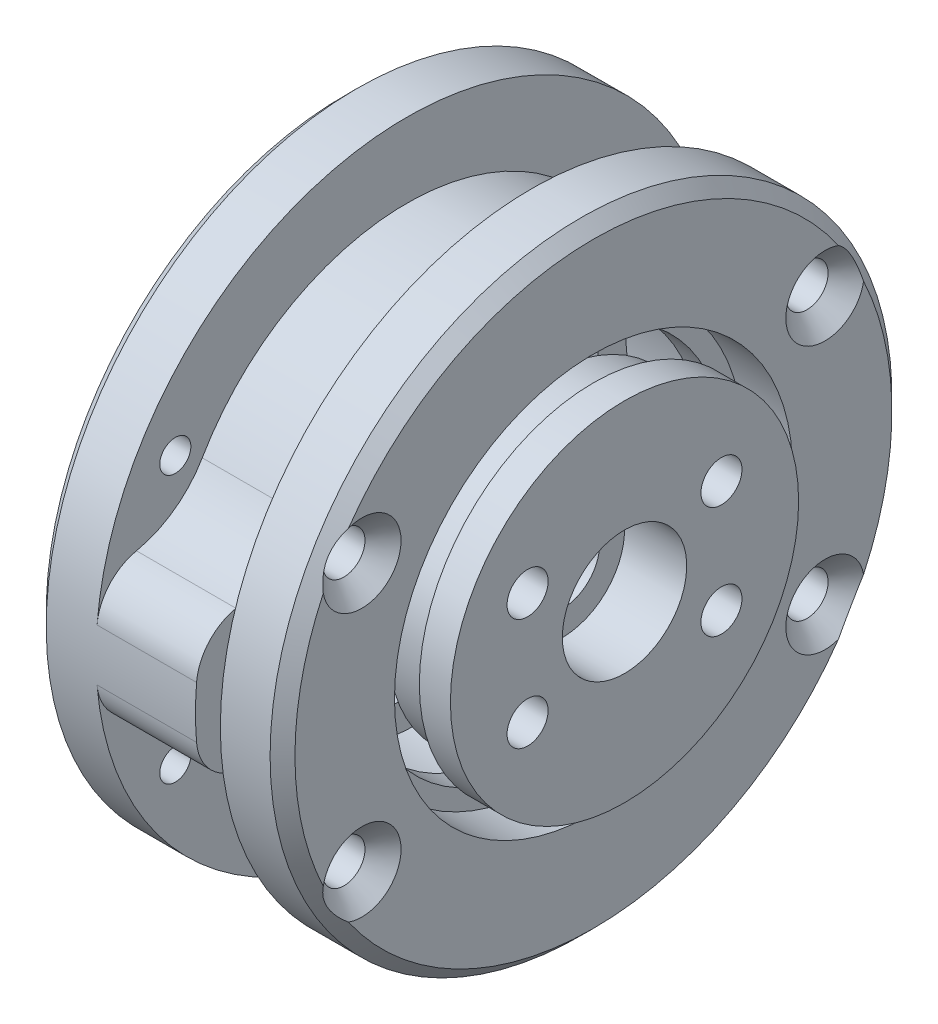
from build123d import *

# Parameters (mm, degrees)
CUT_EXTRUDE1_DEPTH                             = 24.414738948
CUT_EXTRUDE1_DEPTH_BACK                        = 24.414738948
SKETCH3_W                                      = 2
SKETCH3_H                                      = 3.75
CUT_EXTRUDE8_DEPTH                             = 24.414738948
CUT_EXTRUDE8_DEPTH_BACK                        = 24.414738948
SKETCH5_W                                      = 2
SKETCH5_H                                      = 5.5
SKETCH9_W                                      = 1.65
SKETCH9_H                                      = 25
M4X0_7_TAPPED_HOLE1_AT_2_COUNT                 = 2
M4X0_7_TAPPED_HOLE1_AT_2_PITCH                 = 15.588457268
M4X0_7_TAPPED_HOLE1_AT_3_COUNT                 = 2
M4X0_7_TAPPED_HOLE1_AT_3_PITCH                 = 18
M4X0_7_TAPPED_HOLE1_AT_4_COUNT                 = 2
M4X0_7_TAPPED_HOLE1_AT_4_PITCH                 = 9
BOSS_EXTRUDE1_DEPTH                            = 5
BOSS_EXTRUDE1_DEPTH_BACK                       = 3
CSK_FOR_M3_FLAT_HEAD_MACHINE_SCREW1_AT_2_COUNT = 2
CSK_FOR_M3_FLAT_HEAD_MACHINE_SCREW1_AT_2_PITCH = 21.5
CSK_FOR_M3_FLAT_HEAD_MACHINE_SCREW1_AT_3_COUNT = 2
CSK_FOR_M3_FLAT_HEAD_MACHINE_SCREW1_AT_3_PITCH = 37.239092363
CSK_FOR_M3_FLAT_HEAD_MACHINE_SCREW1_AT_4_COUNT = 2
CSK_FOR_M3_FLAT_HEAD_MACHINE_SCREW1_AT_4_PITCH = 43
SKETCH17_W                                     = 1.25
SKETCH17_H                                     = 22.5
M3X0_5_TAPPED_HOLE1_AT_2_COUNT                 = 2
M3X0_5_TAPPED_HOLE1_AT_2_PITCH                 = 21.5
M3X0_5_TAPPED_HOLE1_AT_3_COUNT                 = 2
M3X0_5_TAPPED_HOLE1_AT_3_PITCH                 = 43
M3X0_5_TAPPED_HOLE1_AT_4_COUNT                 = 2
M3X0_5_TAPPED_HOLE1_AT_4_PITCH                 = 37.239092363
CHAMFER2_SIZE                                  = 1
CHAMFER3_SIZE                                  = 1
CUT_EXTRUDE9_DEPTH                             = 44.301270247


with BuildPart() as part:
    # Sketch2 → Revolve1 (revolve)
    with BuildSketch(Plane.XY, mode=Mode.PRIVATE) as revolve1_sk:
        Polygon((-4, 6.5), (5, 6.5), (5, 3), (-2.5, 3), (-2.5, 1.65), (-12.5, 1.65), (-12.5, 14), (-10, 14), (-10, 12.5), (-6, 12.5), (-6, 9.5), (-4, 7.5), align=None)
    revolve(revolve1_sk.sketch.rotate(Axis((-18.53804691, 0, 0), (1, 0, 0)), 90), axis=Axis((-18.53804691, 0, 0), (1, 0, 0)))

    # Sketch3 → Cut-Extrude1 (cut, two sides: drawn at the far end of the back side and taken through both)
    with BuildSketch(Plane.XY.offset(-CUT_EXTRUDE1_DEPTH_BACK)):
        with Locations((4, 4.625)):
            Rectangle(SKETCH3_W, SKETCH3_H)
        with Locations((4, -4.625)):
            Rectangle(SKETCH3_W, SKETCH3_H)
    extrude(amount=CUT_EXTRUDE1_DEPTH + CUT_EXTRUDE1_DEPTH_BACK, mode=Mode.SUBTRACT)


with BuildPart() as body_2:
    # Sketch4 → Revolve2 (revolve)
    with BuildSketch(Plane.XY, mode=Mode.PRIVATE) as revolve2_sk:
        Polygon((4, 6.5), (6, 8.5), (6, 12.5), (10, 12.5), (10, 14), (12.5, 14), (12.5, 5), (7.5, 5), (7.5, 3), (3, 3), (3, 6.5), align=None)
    revolve(revolve2_sk.sketch.rotate(Axis((-18.53804691, 0, 0), (1, 0, 0)), 90), axis=Axis((-18.53804691, 0, 0), (1, 0, 0)))

    # Sketch5 → Cut-Extrude8 (cut, two sides: drawn at the far end of the back side and taken through both)
    with BuildSketch(Plane.XY.offset(-CUT_EXTRUDE8_DEPTH_BACK)):
        with Locations((4, 0)):
            Rectangle(SKETCH5_W, SKETCH5_H)
    extrude(amount=CUT_EXTRUDE8_DEPTH + CUT_EXTRUDE8_DEPTH_BACK, mode=Mode.SUBTRACT)


with BuildPart() as body_3:
    # Sketch6 → Revolve3 (revolve)
    with BuildSketch(Plane.XY, mode=Mode.PRIVATE) as revolve3_sk:
        Polygon((-10, 16), (-10, 25), (-5, 25), (-5, 19), (3, 19), (3, 16.7), (-4, 16.7), (-4, 14.5), (-6, 14.5), (-6, 16), align=None)
    revolve(revolve3_sk.sketch.rotate(Axis((-18.53804691, 0, 0), (1, 0, 0)), 90), axis=Axis((-18.53804691, 0, 0), (1, 0, 0)))

    # Sketch10 → Boss-Extrude1 (add, two sides: drawn at the far end of the back side and taken through both)
    with BuildSketch(Plane.ZY.offset(-BOSS_EXTRUDE1_DEPTH_BACK)):
        with BuildLine():
            ThreePointArc((-16.454482672, 9.5), (-19, 0), (-16.454482672, -9.5))
            ThreePointArc((-16.454482672, -9.5), (-18.691123744, -7.020089159), (-21.745307719, -5.669355538))
            ThreePointArc((-21.745307719, -5.669355538), (-23.92288279, -4.404014641), (-24.912641223, -2.08813489))
            ThreePointArc((-24.912641223, -2.08813489), (-25, 0), (-24.912641223, 2.08813489))
            ThreePointArc((-24.912641223, 2.08813489), (-23.92288279, 4.404014641), (-21.745307719, 5.669355538))
            ThreePointArc((-21.745307719, 5.669355538), (-18.691123744, 7.020089159), (-16.454482672, 9.5))
        make_face()
        with BuildLine():
            ThreePointArc((16.454482672, -9.5), (19, 0), (16.454482672, 9.5))
            ThreePointArc((16.454482672, 9.5), (18.691123744, 7.020089159), (21.745307719, 5.669355538))
            ThreePointArc((21.745307719, 5.669355538), (23.92288279, 4.404014641), (24.912641223, 2.08813489))
            ThreePointArc((24.912641223, 2.08813489), (25, 0), (24.912641223, -2.08813489))
            ThreePointArc((24.912641223, -2.08813489), (23.92288279, -4.404014641), (21.745307719, -5.669355538))
            ThreePointArc((21.745307719, -5.669355538), (18.691123744, -7.020089159), (16.454482672, -9.5))
        make_face()
    extrude(amount=BOSS_EXTRUDE1_DEPTH + BOSS_EXTRUDE1_DEPTH_BACK)

    # Sketch17 → M3x0.5 Tapped Hole1 (revolve, cut)
    with BuildSketch(Plane(origin=(-10, 10.75, 18.619546181), x_dir=(0, 0, 1), z_dir=(0, 1, 0))):
        with Locations((0.625, 11.25)):
            Rectangle(SKETCH17_W, SKETCH17_H)
    m3x0_5_tapped_hole1 = revolve(axis=Axis((-16.35, 10.75, 18.619546181), (1, 0, 0)), mode=Mode.SUBTRACT)

    # M3x0.5 Tapped Hole1 at 2: M3x0.5 Tapped Hole1 ×2
    with Locations(*[(0, -i * M3X0_5_TAPPED_HOLE1_AT_2_PITCH, 0) for i in range(1, M3X0_5_TAPPED_HOLE1_AT_2_COUNT)]):
        add(m3x0_5_tapped_hole1, mode=Mode.SUBTRACT)

    # M3x0.5 Tapped Hole1 at 3: M3x0.5 Tapped Hole1 ×2
    with Locations(*[Vector(0, -0.5000000000000013, -0.8660254037844379) * (i * M3X0_5_TAPPED_HOLE1_AT_3_PITCH) for i in range(1, M3X0_5_TAPPED_HOLE1_AT_3_COUNT)]):
        add(m3x0_5_tapped_hole1, mode=Mode.SUBTRACT)

    # M3x0.5 Tapped Hole1 at 4: M3x0.5 Tapped Hole1 ×2
    with Locations(*[(0, 0, -i * M3X0_5_TAPPED_HOLE1_AT_4_PITCH) for i in range(1, M3X0_5_TAPPED_HOLE1_AT_4_COUNT)]):
        add(m3x0_5_tapped_hole1, mode=Mode.SUBTRACT)

    # Chamfer3
    chamfer3_edges = [body_3.edges().sort_by_distance(p)[0] for p in [
        (-10, 0, -25),
    ]]
    chamfer(chamfer3_edges, length=CHAMFER3_SIZE)


with BuildPart() as body_4:
    # Sketch7 → Revolve4 (revolve)
    with BuildSketch(Plane.XY, mode=Mode.PRIVATE) as revolve4_sk:
        Polygon((4, 16.7), (4, 14.5), (6, 14.5), (6, 16), (10, 16), (10, 25), (5, 25), (5, 19), (3, 19), (3, 16.7), align=None)
    revolve(revolve4_sk.sketch.rotate(Axis((-18.53804691, 0, 0), (1, 0, 0)), 90), axis=Axis((-18.53804691, 0, 0), (1, 0, 0)))

    # Sketch15 → CSK for M3 Flat Head Machine Screw1 (revolve, cut)
    with BuildSketch(Plane(origin=(10, -10.75, 18.619546181), x_dir=(0, 0, -1), z_dir=(0, 1, 0))):
        Polygon((0, 0), (0, 22.5), (1.7, 22.5), (1.7, 1.45), (3.15, 0), align=None)
    csk_for_m3_flat_head_machine_screw1 = revolve(axis=Axis((16.35, -10.75, 18.619546181), (-1, 0, 0)), mode=Mode.SUBTRACT)

    # CSK for M3 Flat Head Machine Screw1 at 2: CSK for M3 Flat Head Machine Screw1 ×2
    with Locations(*[(0, i * CSK_FOR_M3_FLAT_HEAD_MACHINE_SCREW1_AT_2_PITCH, 0) for i in range(1, CSK_FOR_M3_FLAT_HEAD_MACHINE_SCREW1_AT_2_COUNT)]):
        add(csk_for_m3_flat_head_machine_screw1, mode=Mode.SUBTRACT)

    # CSK for M3 Flat Head Machine Screw1 at 3: CSK for M3 Flat Head Machine Screw1 ×2
    with Locations(*[(0, 0, -i * CSK_FOR_M3_FLAT_HEAD_MACHINE_SCREW1_AT_3_PITCH) for i in range(1, CSK_FOR_M3_FLAT_HEAD_MACHINE_SCREW1_AT_3_COUNT)]):
        add(csk_for_m3_flat_head_machine_screw1, mode=Mode.SUBTRACT)

    # CSK for M3 Flat Head Machine Screw1 at 4: CSK for M3 Flat Head Machine Screw1 ×2
    with Locations(*[Vector(0, 0.5000000000000013, -0.8660254037844379) * (i * CSK_FOR_M3_FLAT_HEAD_MACHINE_SCREW1_AT_4_PITCH) for i in range(1, CSK_FOR_M3_FLAT_HEAD_MACHINE_SCREW1_AT_4_COUNT)]):
        add(csk_for_m3_flat_head_machine_screw1, mode=Mode.SUBTRACT)

    # Chamfer2
    # the kernel refuses this chamfer: 1 mm, written as the material it takes off along each edge
    with BuildSketch(Plane(origin=(10, 0, 0), x_dir=(0, 0, 1), z_dir=(0, 1, 0))) as chamfer2_piece_1:
        Polygon((25 - CHAMFER2_SIZE, 0), (25, -CHAMFER2_SIZE), (25, 0), align=None)
    revolve(axis=Axis((10, 0, 0), (1, 0, 0)), mode=Mode.SUBTRACT)


with BuildPart() as m4x0_7_tapped_hole1_tool:
    # Sketch9 → M4x0.7 Tapped Hole1 (revolve)
    with BuildSketch(Plane(origin=(-12.5, 4.5, -7.794228634), x_dir=(0, 0, 1), z_dir=(0, 1, 0))):
        with Locations((0.825, 12.5)):
            Rectangle(SKETCH9_W, SKETCH9_H)
    m4x0_7_tapped_hole1 = revolve(axis=Axis((-18.85, 4.5, -7.794228634), (1, 0, 0)))


with BuildPart() as part_1:
    add(part.part)

    # M4x0.7 Tapped Hole1: cut by m4x0_7_tapped_hole1_tool
    add(m4x0_7_tapped_hole1_tool.part, mode=Mode.SUBTRACT)


with BuildPart() as body_2_1:
    add(body_2.part)

    # M4x0.7 Tapped Hole1: cut by m4x0_7_tapped_hole1_tool
    add(m4x0_7_tapped_hole1_tool.part, mode=Mode.SUBTRACT)


with BuildPart() as m4x0_7_tapped_hole1_at_2_tool:
    # M4x0.7 Tapped Hole1 at 2: M4x0.7 Tapped Hole1 ×2
    with Locations(*[(0, 0, i * M4X0_7_TAPPED_HOLE1_AT_2_PITCH) for i in range(1, M4X0_7_TAPPED_HOLE1_AT_2_COUNT)]):
        add(m4x0_7_tapped_hole1)


with BuildPart() as part_2:
    add(part_1.part)

    # M4x0.7 Tapped Hole1 at 2: cut by m4x0_7_tapped_hole1_at_2_tool
    add(m4x0_7_tapped_hole1_at_2_tool.part, mode=Mode.SUBTRACT)


with BuildPart() as body_2_2:
    add(body_2_1.part)

    # M4x0.7 Tapped Hole1 at 2: cut by m4x0_7_tapped_hole1_at_2_tool
    add(m4x0_7_tapped_hole1_at_2_tool.part, mode=Mode.SUBTRACT)


with BuildPart() as m4x0_7_tapped_hole1_at_3_tool:
    # M4x0.7 Tapped Hole1 at 3: M4x0.7 Tapped Hole1 ×2
    with Locations(*[Vector(0, -0.5, 0.8660254037844387) * (i * M4X0_7_TAPPED_HOLE1_AT_3_PITCH) for i in range(1, M4X0_7_TAPPED_HOLE1_AT_3_COUNT)]):
        add(m4x0_7_tapped_hole1)


with BuildPart() as part_3:
    add(part_2.part)

    # M4x0.7 Tapped Hole1 at 3: cut by m4x0_7_tapped_hole1_at_3_tool
    add(m4x0_7_tapped_hole1_at_3_tool.part, mode=Mode.SUBTRACT)


with BuildPart() as body_2_3:
    add(body_2_2.part)

    # M4x0.7 Tapped Hole1 at 3: cut by m4x0_7_tapped_hole1_at_3_tool
    add(m4x0_7_tapped_hole1_at_3_tool.part, mode=Mode.SUBTRACT)


with BuildPart() as m4x0_7_tapped_hole1_at_4_tool:
    # M4x0.7 Tapped Hole1 at 4: M4x0.7 Tapped Hole1 ×2
    with Locations(*[(0, -i * M4X0_7_TAPPED_HOLE1_AT_4_PITCH, 0) for i in range(1, M4X0_7_TAPPED_HOLE1_AT_4_COUNT)]):
        add(m4x0_7_tapped_hole1)


with BuildPart() as part_4:
    add(part_3.part)

    # M4x0.7 Tapped Hole1 at 4: cut by m4x0_7_tapped_hole1_at_4_tool
    add(m4x0_7_tapped_hole1_at_4_tool.part, mode=Mode.SUBTRACT)

    # Sketch18 → Cut-Extrude9 (cut, through all)
    with BuildSketch(Plane.ZY.offset(12.5)):
        with BuildLine():
            Line((-4.5, 13.257073584), (-4.5, 7.257073584))
            Line((-4.5, 7.257073584), (4.5, 7.257073584))
            Line((4.5, 7.257073584), (4.5, 13.257073584))
            ThreePointArc((4.5, 13.257073584), (0, 14), (-4.5, 13.257073584))
        make_face()
    extrude(amount=-CUT_EXTRUDE9_DEPTH, mode=Mode.SUBTRACT)


with BuildPart() as body_2_4:
    add(body_2_3.part)

    # M4x0.7 Tapped Hole1 at 4: cut by m4x0_7_tapped_hole1_at_4_tool
    add(m4x0_7_tapped_hole1_at_4_tool.part, mode=Mode.SUBTRACT)


solid = Compound([body_3.part, body_4.part, part_4.part, body_2_4.part])
